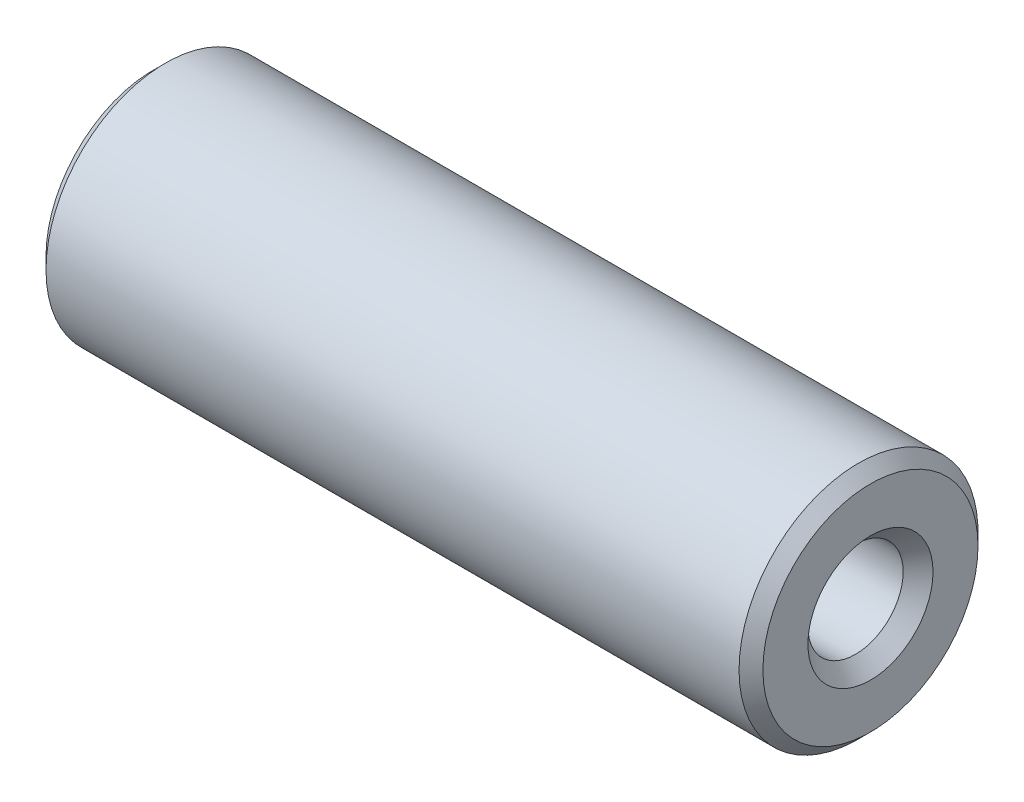
from build123d import *

# Parameters (mm, degrees)
SKETCH1_R           = 25.4
SKETCH1_R_2         = 10.12063
BOSS_EXTRUDE1_DEPTH = 152.4
CHAMFER1_SIZE       = 2.54
CHAMFER2_SIZE       = 3.175


with BuildPart() as part:
    # Sketch1 → Boss-Extrude1 (new body)
    with BuildSketch(Plane(origin=(0, 0, 0), x_dir=(0, 0, -1), z_dir=(1, 0, 0))):
        Circle(SKETCH1_R)
        Circle(SKETCH1_R_2, mode=Mode.SUBTRACT)
    extrude(amount=BOSS_EXTRUDE1_DEPTH)

    # Chamfer1
    chamfer1_edges = [part.edges().sort_by_distance(p)[0] for p in [
        (0, 0, 25.4),
        (152.4, 0, 25.4),
    ]]
    chamfer(chamfer1_edges, length=CHAMFER1_SIZE)

    # Chamfer2
    chamfer2_edges = [part.edges().sort_by_distance(p)[0] for p in [
        (0, 0, 10.12063),
        (152.4, 0, 10.12063),
    ]]
    chamfer(chamfer2_edges, length=CHAMFER2_SIZE)


solid = part.part
